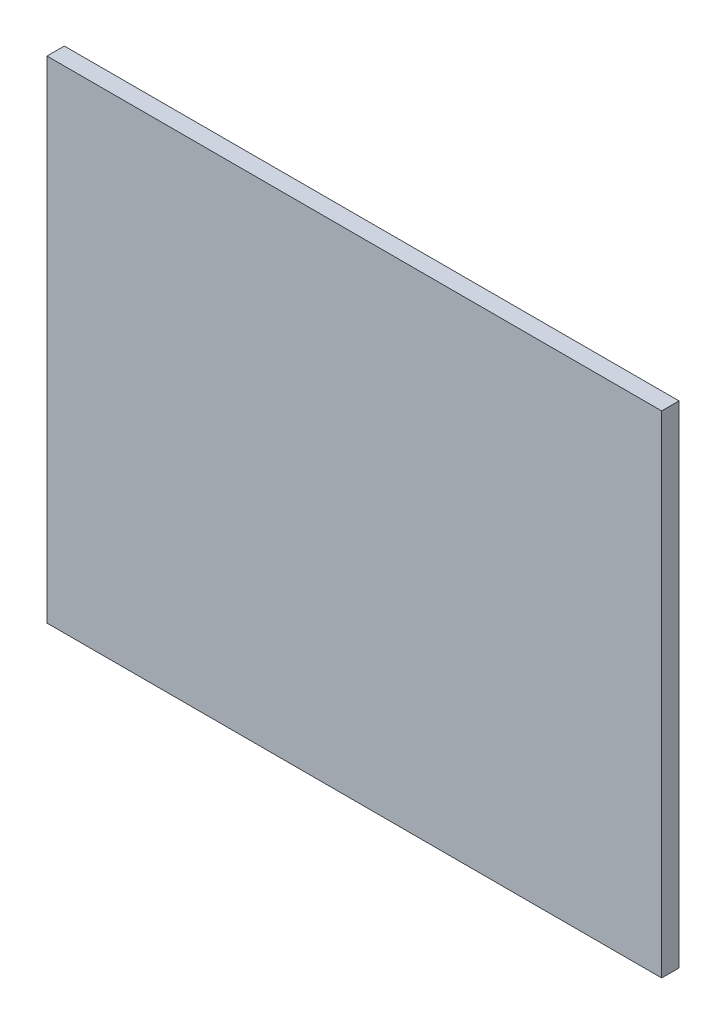
from build123d import *

# Parameters (mm, degrees)
SKETCH1_W           = 112.65
SKETCH1_H           = 90
BOSS_EXTRUDE1_DEPTH = 3.175


with BuildPart() as part:
    # Sketch1 → Boss-Extrude1 (new body)
    with BuildSketch(Plane.XY):
        Rectangle(SKETCH1_W, SKETCH1_H)
    extrude(amount=BOSS_EXTRUDE1_DEPTH)


solid = part.part
